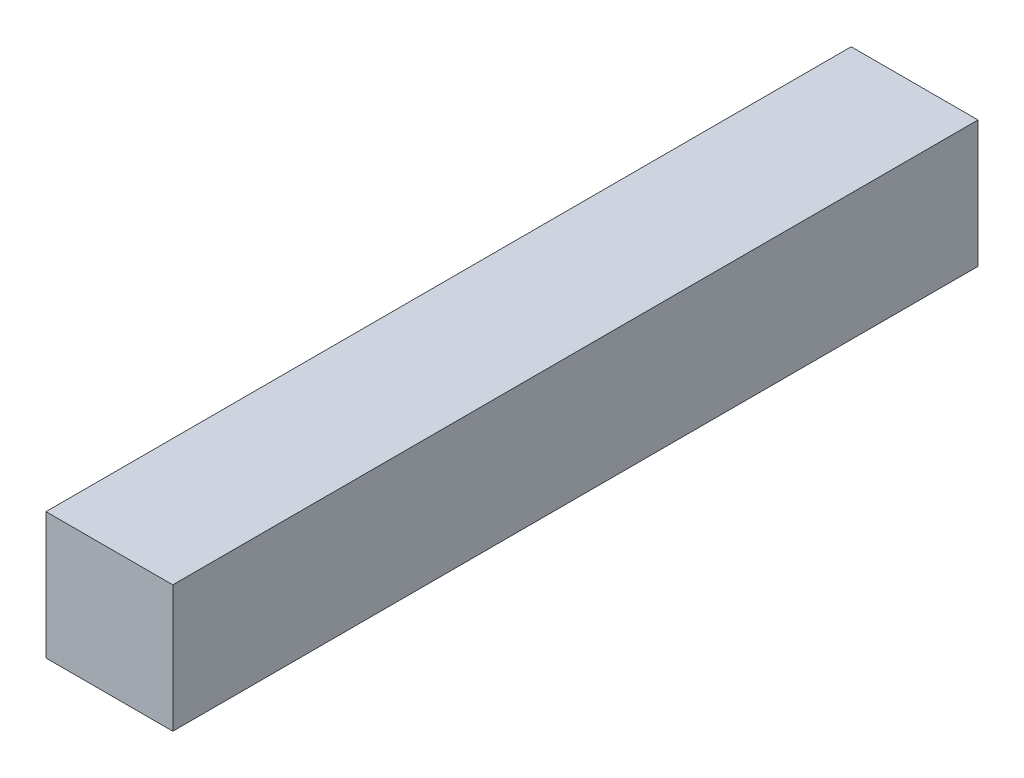
from build123d import *

# Parameters (mm, degrees)
SKETCH1_W           = 2
SKETCH1_H           = 2
BOSS_EXTRUDE1_DEPTH = 12.7


with BuildPart() as part:
    # Sketch1 → Boss-Extrude1 (new body)
    with BuildSketch(Plane.XY):
        Rectangle(SKETCH1_W, SKETCH1_H)
    extrude(amount=BOSS_EXTRUDE1_DEPTH)


solid = part.part
